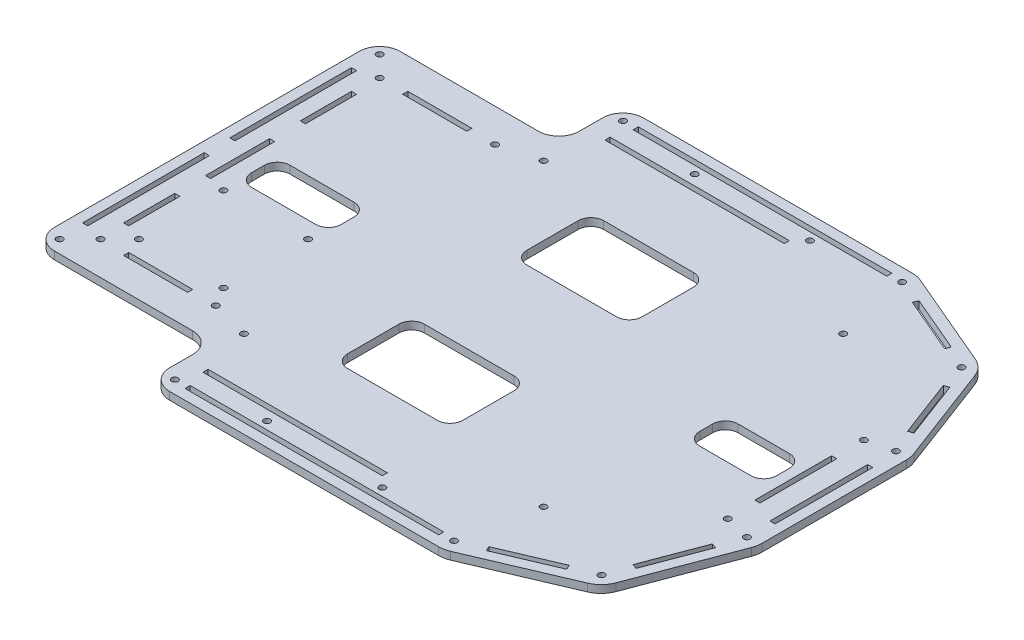
from build123d import *

# Parameters (mm, degrees)
ESTRUSIONE_ESTRUSIONE1_DEPTH  = 3
FORO_FILETTATO_M3X0_5_1_D     = 2.5
FORO_FILETTATO_M3X0_5_1_DEPTH = 7.5
FORO_FILETTATO_M3X0_5_1_TIP   = 0.751075774
SCHIZZO4_W                    = 89.03043591
SCHIZZO4_H                    = 2
TAGLIO_ESTRUSIONE2_DEPTH      = 10
FORO_FILETTATO_M3X0_5_7_D     = 2.5
SCHIZZO29_W                   = 5
SCHIZZO29_H                   = 2
TAGLIO_ESTRUSIONE13_DEPTH     = 10
SCHIZZO7_W                    = 2
SCHIZZO7_H                    = 47.5
TAGLIO_ESTRUSIONE5_DEPTH      = 10
SCHIZZO10_W                   = 2
SCHIZZO10_H                   = 38.172865154
TAGLIO_ESTRUSIONE6_DEPTH      = 262.897403576
FORO_FILETTATO_M3X0_5_2_D     = 2.5
SCHIZZO17_W                   = 25
SCHIZZO17_H                   = 2
SCHIZZO17_W_2                 = 2
SCHIZZO17_H_2                 = 20
SCHIZZO17_H_3                 = 25
TAGLIO_ESTRUSIONE9_DEPTH      = 10
SCHIZZO18_W                   = 70
SCHIZZO18_H                   = 2
TAGLIO_ESTRUSIONE10_DEPTH     = 10
FORO_FILETTATO_M3X0_5_3_D     = 2.5
SCHIZZO25_W                   = 2
SCHIZZO25_H                   = 30
TAGLIO_ESTRUSIONE11_DEPTH     = 10
FORO_FILETTATO_M3X0_5_6_D     = 2.5
SCHIZZO36_W                   = 30
SCHIZZO36_H                   = 15
TAGLIO_ESTRUSIONE15_DEPTH     = 10
SCHIZZO37_W                   = 35
SCHIZZO37_H                   = 15
TAGLIO_ESTRUSIONE16_DEPTH     = 10
SCHIZZO38_W                   = 45
SCHIZZO38_H                   = 30
TAGLIO_ESTRUSIONE17_DEPTH     = 10
FORO_FILETTATO_M3X0_5_9_D     = 2.5
RACCORDO1_R                   = 8
RACCORDO2_R                   = 10
RACCORDO3_R                   = 5


with BuildPart() as part:
    # Schizzo1 → Estrusione-Estrusione1 (new body)
    with BuildSketch(Plane(origin=(0, 0, 0), x_dir=(1, 0, 0), z_dir=(0, 1, 0))):
        Polygon((70, 67.5), (70, 92.5), (185.052105959, 92.5), (228.353376148, 74.033119315), (245, 30), (245, -30), (228.353376148, -74.033119315), (185.052105959, -92.5), (70, -92.5), (70, -67.5), (0, -67.5), (0, 67.5), align=None)
    extrude(amount=ESTRUSIONE_ESTRUSIONE1_DEPTH)

    # Foro filettato M3x0.5-1
    with Locations(Plane(origin=(0, 3, 0), x_dir=(1, 0, 0), z_dir=(0, 1, 0))):
        with Locations((224.430485984, 70.270415253), (240, 29.086432577), (240, -29.086432577), (224.430485984, -70.270415253), (184.03043591, -87.5), (184.03043591, 87.5), (75, 87.5), (75, -87.5), (5, -62.5), (5, 62.5)):
            Hole(FORO_FILETTATO_M3X0_5_1_D / 2, depth=FORO_FILETTATO_M3X0_5_1_DEPTH)
            with Locations((0, 0, -(FORO_FILETTATO_M3X0_5_1_DEPTH + FORO_FILETTATO_M3X0_5_1_TIP / 2))):  # 118° drill point
                Cone(0, FORO_FILETTATO_M3X0_5_1_D / 2, FORO_FILETTATO_M3X0_5_1_TIP, mode=Mode.SUBTRACT)

    # Schizzo4 → Taglio-Estrusione2 (cut)
    with BuildSketch(Plane(origin=(0, 3, 0), x_dir=(1, 0, 0), z_dir=(0, 1, 0))):
        with Locations((129.515217955, -87.5)):
            Rectangle(SCHIZZO4_W, SCHIZZO4_H)
        Polygon((235.52839554, 38.086696659), (227.03131331, 60.562907992), (228.902090444, 61.27015117), (237.399172674, 38.793939838), align=None)
        with Locations((129.515217955, 87.5)):
            Rectangle(SCHIZZO4_W, SCHIZZO4_H)
        Polygon((215.624354877, 75.113147429), (193.62114505, 84.496951848), (192.836567017, 82.657267824), (214.839776844, 73.273463404), align=None)
        Polygon((192.836567017, -82.657267824), (214.839776844, -73.273463404), (215.624354877, -75.113147429), (193.62114505, -84.496951848), align=None)
        Polygon((227.03131331, -60.562907992), (235.52839554, -38.086696659), (237.399172674, -38.793939838), (228.902090444, -61.27015117), align=None)
    extrude(amount=-TAGLIO_ESTRUSIONE2_DEPTH, mode=Mode.SUBTRACT)

    # Foro filettato M3x0.5-7 (through all)
    with Locations(Plane(origin=(0, 3, 0), x_dir=(1, 0, 0), z_dir=(0, 1, 0))):
        with Locations((107.015217955, -83.5), (152.015217955, -83.5)):
            foro_filettato_m3x0_5_7 = Hole(FORO_FILETTATO_M3X0_5_7_D / 2)

    # Schizzo29 → Taglio-Estrusione13 (cut)
    with BuildSketch(Plane(origin=(0, 3, 0), x_dir=(1, 0, 0), z_dir=(0, 1, 0))):
        with Locations((82.5, -87.5)):
            Rectangle(SCHIZZO29_W, SCHIZZO29_H)
        with Locations((176.53043591, -87.5)):
            Rectangle(SCHIZZO29_W, SCHIZZO29_H)
    taglio_estrusione13 = extrude(amount=-TAGLIO_ESTRUSIONE13_DEPTH, mode=Mode.SUBTRACT)

    # Specchia2: Foro filettato M3x0.5-7, Taglio-Estrusione13 across plane
    add(foro_filettato_m3x0_5_7.mirror(Plane.XY), mode=Mode.SUBTRACT)
    add(taglio_estrusione13.mirror(Plane.XY), mode=Mode.SUBTRACT)

    # Schizzo7 → Taglio-Estrusione5 (cut)
    with BuildSketch(Plane(origin=(0, 3, 0), x_dir=(1, 0, 0), z_dir=(0, 1, 0))):
        with Locations((5, 28.75)):
            Rectangle(SCHIZZO7_W, SCHIZZO7_H)
        with Locations((5, -28.75)):
            Rectangle(SCHIZZO7_W, SCHIZZO7_H)
    extrude(amount=-TAGLIO_ESTRUSIONE5_DEPTH, mode=Mode.SUBTRACT)

    # Schizzo10 → Taglio-Estrusione6 (cut, through all)
    with BuildSketch(Plane(origin=(0, 3, 0), x_dir=(1, 0, 0), z_dir=(0, 1, 0))):
        with Locations((240, 0)):
            Rectangle(SCHIZZO10_W, SCHIZZO10_H)
    extrude(amount=-TAGLIO_ESTRUSIONE6_DEPTH, mode=Mode.SUBTRACT)

    # Foro filettato M3x0.5-2 (through all)
    with Locations(Plane(origin=(0, 3, 0), x_dir=(1, 0, 0), z_dir=(0, 1, 0))):
        with Locations((13, 54.5), (13, -54.5), (58, -54.5), (58, 54.5)):
            Hole(FORO_FILETTATO_M3X0_5_2_D / 2)

    # Schizzo17 → Taglio-Estrusione9 (cut)
    with BuildSketch(Plane(origin=(0, 3, 0), x_dir=(1, 0, 0), z_dir=(0, 1, 0))):
        with Locations((35.5, -54.5)):
            Rectangle(SCHIZZO17_W, SCHIZZO17_H)
        with Locations((13, -34.5)):
            Rectangle(SCHIZZO17_W_2, SCHIZZO17_H_2)
        with Locations((13, 34.5)):
            Rectangle(SCHIZZO17_W_2, SCHIZZO17_H_2)
        with Locations((35.5, 54.5)):
            Rectangle(SCHIZZO17_W, SCHIZZO17_H)
        with Locations((13, 0)):
            Rectangle(SCHIZZO17_W_2, SCHIZZO17_H_3)
    extrude(amount=-TAGLIO_ESTRUSIONE9_DEPTH, mode=Mode.SUBTRACT)

    # Schizzo18 → Taglio-Estrusione10 (cut)
    with BuildSketch(Plane(origin=(0, 3, 0), x_dir=(1, 0, 0), z_dir=(0, 1, 0))):
        with Locations((113, 78.5)):
            Rectangle(SCHIZZO18_W, SCHIZZO18_H)
        with Locations((113, -78.5)):
            Rectangle(SCHIZZO18_W, SCHIZZO18_H)
    extrude(amount=-TAGLIO_ESTRUSIONE10_DEPTH, mode=Mode.SUBTRACT)

    # Foro filettato M3x0.5-3 (through all)
    with Locations(Plane(origin=(0, 3, 0), x_dir=(1, 0, 0), z_dir=(0, 1, 0))):
        with Locations((230, 26.586432577), (230, -26.586432577)):
            Hole(FORO_FILETTATO_M3X0_5_3_D / 2)

    # Schizzo25 → Taglio-Estrusione11 (cut)
    with BuildSketch(Plane(origin=(0, 3, 0), x_dir=(1, 0, 0), z_dir=(0, 1, 0))):
        with Locations((230, 0)):
            Rectangle(SCHIZZO25_W, SCHIZZO25_H)
    extrude(amount=-TAGLIO_ESTRUSIONE11_DEPTH, mode=Mode.SUBTRACT)

    # Foro filettato M3x0.5-6 (through all)
    with Locations(Plane(origin=(0, 3, 0), x_dir=(1, 0, 0), z_dir=(0, 1, 0))):
        with Locations((73, 58.5), (190, 58.5), (190, -58.5), (73, -58.5)):
            Hole(FORO_FILETTATO_M3X0_5_6_D / 2)

    # Schizzo36 → Taglio-Estrusione15 (cut)
    with BuildSketch(Plane(origin=(0, 3, 0), x_dir=(1, 0, 0), z_dir=(0, 1, 0))):
        with Locations((210, 0)):
            Rectangle(SCHIZZO36_W, SCHIZZO36_H)
    extrude(amount=-TAGLIO_ESTRUSIONE15_DEPTH, mode=Mode.SUBTRACT)

    # Schizzo37 → Taglio-Estrusione16 (cut)
    with BuildSketch(Plane(origin=(0, 3, 0), x_dir=(1, 0, 0), z_dir=(0, 1, 0))):
        with Locations((37.5, 0)):
            Rectangle(SCHIZZO37_W, SCHIZZO37_H)
    extrude(amount=-TAGLIO_ESTRUSIONE16_DEPTH, mode=Mode.SUBTRACT)

    # Schizzo38 → Taglio-Estrusione17 (cut)
    with BuildSketch(Plane(origin=(0, 3, 0), x_dir=(1, 0, 0), z_dir=(0, 1, 0))):
        with Locations((122.5, 35)):
            Rectangle(SCHIZZO38_W, SCHIZZO38_H)
        with Locations((122.5, -35)):
            Rectangle(SCHIZZO38_W, SCHIZZO38_H)
    extrude(amount=-TAGLIO_ESTRUSIONE17_DEPTH, mode=Mode.SUBTRACT)

    # Foro filettato M3x0.5-9 (through all)
    with Locations(Plane(origin=(0, 3, 0), x_dir=(1, 0, 0), z_dir=(0, 1, 0))):
        with Locations((20.49, -47.01), (53.51, -47.01), (53.51, -13.99), (20.49, -13.99)):
            Hole(FORO_FILETTATO_M3X0_5_9_D / 2)

    # Raccordo1
    raccordo1_edges = [part.edges().sort_by_distance(p)[0] for p in [
        (0, 1.5, 67.5),
        (0, 1.5, -67.5),
        (70, 1.5, -92.5),
        (70, 1.5, 92.5),
        (70, 1.5, 67.5),
        (70, 1.5, -67.5),
    ]]
    fillet(raccordo1_edges, radius=RACCORDO1_R)

    # Raccordo2
    raccordo2_edges = [part.edges().sort_by_distance(p)[0] for p in [
        (185.052105959, 1.5, -92.5),
        (228.353376148, 1.5, -74.033119315),
        (245, 1.5, -30),
        (245, 1.5, 30),
        (228.353376148, 1.5, 74.033119315),
        (185.052105959, 1.5, 92.5),
    ]]
    fillet(raccordo2_edges, radius=RACCORDO2_R)

    # Raccordo3
    raccordo3_edges = [part.edges().sort_by_distance(p)[0] for p in [
        (195, 1.5, -7.5),
        (195, 1.5, 7.5),
        (225, 1.5, -7.5),
        (225, 1.5, 7.5),
        (55, 1.5, 7.5),
        (20, 1.5, 7.5),
        (20, 1.5, -7.5),
        (55, 1.5, -7.5),
        (100, 1.5, 20),
        (145, 1.5, 20),
        (100, 1.5, 50),
        (145, 1.5, 50),
        (145, 1.5, -20),
        (100, 1.5, -20),
        (100, 1.5, -50),
        (145, 1.5, -50),
    ]]
    fillet(raccordo3_edges, radius=RACCORDO3_R)


solid = part.part
